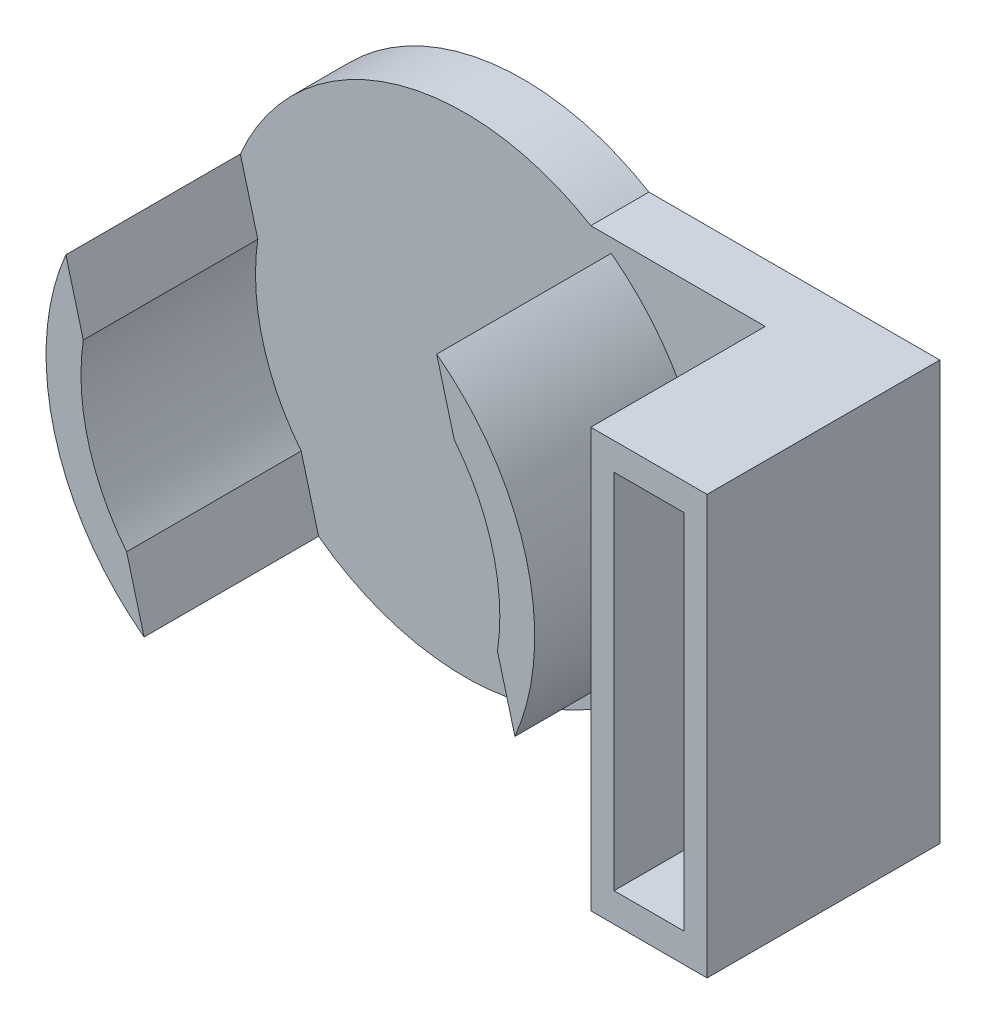
from build123d import *

# Parameters (mm, degrees)
ESTRUSIONE_ESTRUSIONE1_DEPTH = 2.5
SCHIZZO2_W                   = 10
SCHIZZO2_H                   = 36
ESTRUSIONE_ESTRUSIONE2_DEPTH = 15
SCHIZZO3_W                   = 6
SCHIZZO3_H                   = 31.15
TAGLIO_ESTRUSIONE1_DEPTH     = 13
ESTRUSIONE_SOTTILE1_START    = 15
SCHIZZO5_R                   = 21
SCHIZZO5_R_2                 = 18
ESTRUSIONE_SOTTILE1_DEPTH    = 15
SCHIZZO8_W                   = 33
SCHIZZO8_H                   = 15
TAGLIO_ESTRUSIONE2_DEPTH     = 67.005918474


with BuildPart() as part:
    # Schizzo1 → Estrusione-Estrusione1 (new, symmetric)
    with BuildSketch(Plane.XY):
        with BuildLine():
            Line((22.36549987, -24.390648792), (47.36549987, -24.390648792))
            Line((47.36549987, -24.390648792), (47.36549987, 11.609351208))
            Line((47.36549987, 11.609351208), (22.36549987, 11.609351208))
            ThreePointArc((22.36549987, 11.609351208), (-9.451153957, -6.390648792), (22.36549987, -24.390648792))
        make_face()
    extrude(amount=ESTRUSIONE_ESTRUSIONE1_DEPTH, both=True)

    # Schizzo2 → Estrusione-Estrusione2 (add)
    with BuildSketch(Plane.XY.offset(2.5)):
        with Locations((42.36549987, -6.390648792)):
            Rectangle(SCHIZZO2_W, SCHIZZO2_H)
    extrude(amount=ESTRUSIONE_ESTRUSIONE2_DEPTH)

    # Schizzo3 → Taglio-Estrusione1 (cut)
    with BuildSketch(Plane.XY.offset(17.5)):
        with Locations((42.36549987, -6.315648792)):
            Rectangle(SCHIZZO3_W, SCHIZZO3_H)
    extrude(amount=-TAGLIO_ESTRUSIONE1_DEPTH, mode=Mode.SUBTRACT)

    # Schizzo5 → Estrusione-Sottile1 (add)
    with BuildSketch(Plane.XY.offset(2.5).offset(ESTRUSIONE_SOTTILE1_START)):
        with Locations((11.548846043, -6.390648792)):
            Circle(SCHIZZO5_R)
        with Locations((11.548846043, -6.390648792)):
            Circle(SCHIZZO5_R_2, mode=Mode.SUBTRACT)
    extrude(amount=-ESTRUSIONE_SOTTILE1_DEPTH)

    # Schizzo8 → Taglio-Estrusione2 (cut, through all)
    with BuildSketch(Plane(origin=(-3.063911756, 11.434674345, 0), x_dir=(0.9659258262890695, 0.2588190451025161, 0), z_dir=(-0.2588190451025161, 0.9659258262890696, 0))):
        with Locations((9.501307039, -10)):
            Rectangle(SCHIZZO8_W, SCHIZZO8_H)
    extrude(amount=-TAGLIO_ESTRUSIONE2_DEPTH, mode=Mode.SUBTRACT)


solid = part.part
